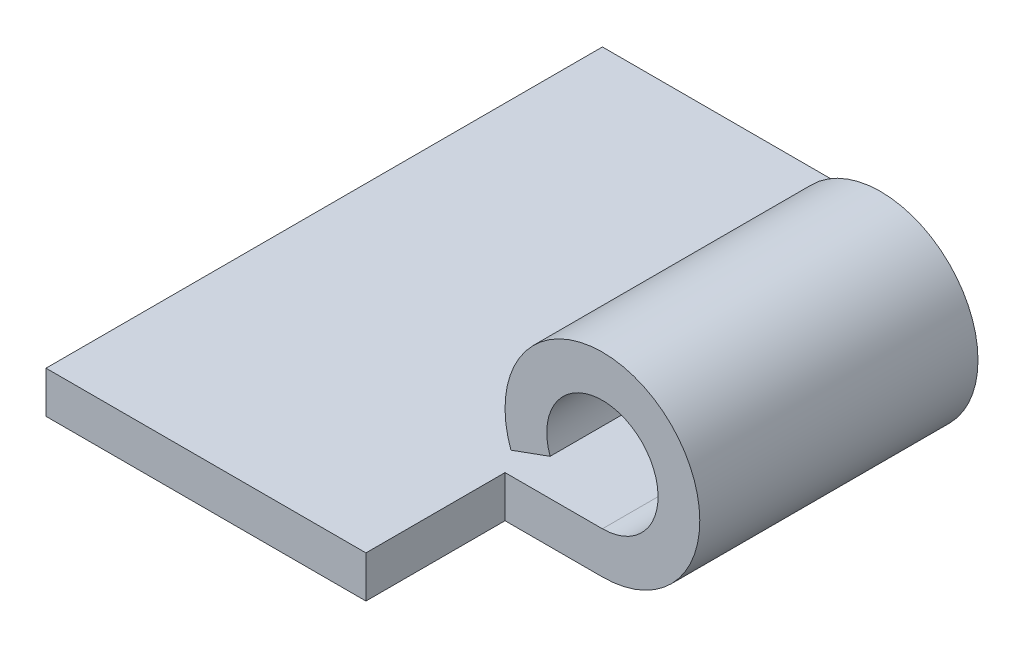
from build123d import *

# Parameters (mm, degrees)
BASE_FLANGE1_DEPTH      = 10
CUT_EXTRUDE1_DEPTH      = 22.737065119
CUT_EXTRUDE1_DEPTH_BACK = 22.737065119
SKETCH11_W              = 7
SKETCH11_H              = 5


# Sheet-metal steps are written as plain solids
with BuildPart() as part:
    # Sketch1 → Base-Flange1 (new, symmetric)
    with BuildSketch(Plane.XY):
        with BuildLine():
            Line((0, 0), (15, 0))
            ThreePointArc((15, 0), (16.147152873, 3.638304089), (13.120614758, 1.315959713))
            Line((13.120614758, 1.315959713), (11.711075827, 0.802929498))
            ThreePointArc((11.711075827, 0.802929498), (17.007517527, 4.867032155), (15, -1.5))
            Line((15, -1.5), (0, -1.5))
            Line((0, -1.5), (0, 0))
        make_face()
    extrude(amount=BASE_FLANGE1_DEPTH, both=True)

    # Sketch11 → Cut-Extrude1 (cut, two sides: drawn at the far end of the back side and taken through both)
    with BuildSketch(Plane(origin=(0, 0, 0), x_dir=(1, 0, 0), z_dir=(0, 1, 0)).offset(-CUT_EXTRUDE1_DEPTH_BACK)):
        with Locations((15, 7.5)):
            Rectangle(SKETCH11_W, SKETCH11_H)
        with Locations((15, -7.5)):
            Rectangle(SKETCH11_W, SKETCH11_H)
    extrude(amount=CUT_EXTRUDE1_DEPTH + CUT_EXTRUDE1_DEPTH_BACK, mode=Mode.SUBTRACT)


solid = part.part
